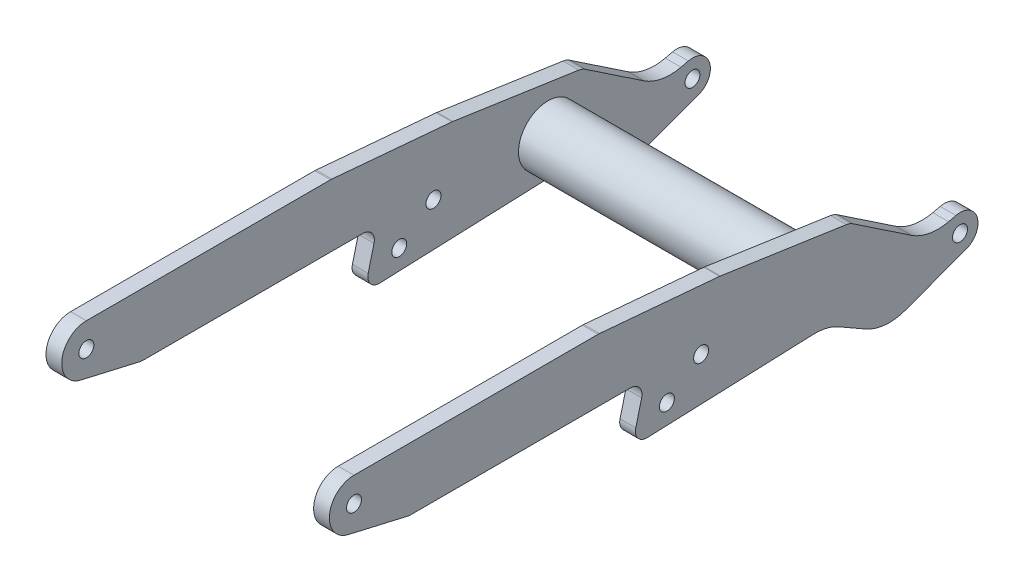
from build123d import *

# Parameters (mm, degrees)
SKETCH1_R                = 0.95
BOSS_EXTRUDE1_DEPTH      = 18
FILLET1_R                = 2
CUT_EXTRUDE1_DEPTH       = 83.510909783
CUT_EXTRUDE1_DEPTH_BACK  = 83.510909783
SKETCH2_W                = 32
SKETCH2_H                = 82.41
BOSS_EXTRUDE2_DEPTH      = 18
BOSS_EXTRUDE2_DEPTH_BACK = 16
SKETCH3_R                = 3.75


with BuildPart() as part:
    # Sketch1 → Boss-Extrude1 (new, symmetric)
    with BuildSketch(Plane(origin=(0, 0, 0), x_dir=(0, 0, -1), z_dir=(1, 0, 0))):
        with BuildLine():
            Line((0, 3.13), (31.1, 3.13))
            Line((31.1, 3.13), (46.5, 1.782674582))
            Line((46.5, 1.782674582), (63, -0.639122384))
            Line((63, -0.639122384), (70.830854785, -5.891324783))
            ThreePointArc((70.830854785, -5.891324783), (73.097482442, -6.811154728), (75.542872081, -6.749855612))
            Line((75.542872081, -6.749855612), (76.479440337, -6.530221264))
            ThreePointArc((76.479440337, -6.530221264), (79.183707452, -8.094392066), (77.788191978, -10.889428289))
            Line((77.788191978, -10.889428289), (70.085210842, -13.7273023))
            ThreePointArc((70.085210842, -13.7273023), (67.51150317, -14.076398492), (65.031397439, -13.305091226))
            Line((65.031397439, -13.305091226), (61.593330792, -11.338037731))
            ThreePointArc((61.593330792, -11.338037731), (60.042423522, -10.718485849), (58.380824128, -10.550422334))
            Line((58.380824128, -10.550422334), (37.261773194, -11.370750671))
            ThreePointArc((37.261773194, -11.370750671), (36.078702039, -10.834444885), (35.799894202, -9.565765476))
            Line((35.799894202, -9.565765476), (36.542469609, -6.634487021))
            ThreePointArc((36.542469609, -6.634487021), (36.281163577, -5.387851181), (35.136870597, -4.828409195))
            Line((35.136870597, -4.828409195), (7, -4.828409195))
            Line((7, -4.828409195), (-0.7040968, -3.049778303))
            ThreePointArc((-0.7040968, -3.049778303), (-3.109879908, 0.354326059), (0, 3.13))
        make_face()
        Circle(SKETCH1_R, mode=Mode.SUBTRACT)
        with Locations((44.1, -5.6)):
            Circle(SKETCH1_R, mode=Mode.SUBTRACT)
        with Locations((39.75, -8.75)):
            Circle(SKETCH1_R, mode=Mode.SUBTRACT)
        with Locations((77, -8.75)):
            Circle(SKETCH1_R, mode=Mode.SUBTRACT)
    extrude(amount=BOSS_EXTRUDE1_DEPTH, both=True)

    # Fillet1
    # the kernel refuses this fillet: 2 mm, written as the material it takes off along each edge
    with BuildSketch(Plane(origin=(19.131384491, -0.639122384, -63), x_dir=(0, -0.557020574337694, -0.8304986934152909), z_dir=(-1, 0, 0))) as fillet1_piece_1:
        with BuildLine():
            CenterArc((FILLET1_R * 0.226276898255, FILLET1_R), FILLET1_R, 244.5, 25.5)
            Line((-FILLET1_R * 0.204234198553, FILLET1_R * 0.0974147156501), (0, 0))
            Line((0, 0), (FILLET1_R * 0.226276898255, 0))
        make_face()
    extrude(amount=38.262768983, mode=Mode.SUBTRACT)
    with BuildSketch(Plane(origin=(-18.569678042, -4.828409195, -7), x_dir=(0, 0.22495105434386356, 0.9743700647852356), z_dir=(1, 0, 0))) as fillet1_piece_2:
        with BuildLine():
            CenterArc((FILLET1_R * 0.113935608302, -FILLET1_R), FILLET1_R, 90, 13)
            Line((-FILLET1_R * 0.111015446042, -FILLET1_R * 0.0256299352148), (0, 0))
            Line((0, 0), (FILLET1_R * 0.113935608302, 0))
        make_face()
    extrude(amount=37.139356083, mode=Mode.SUBTRACT)
    with BuildSketch(Plane(origin=(18.218304715, 3.13, -31.1), x_dir=(0, 0, 1), z_dir=(-1, 0, 0))) as fillet1_piece_3:
        with BuildLine():
            CenterArc((FILLET1_R * 0.0436609429085, -FILLET1_R), FILLET1_R, 90, 5)
            Line((-FILLET1_R * 0.0434947998391, -FILLET1_R * 0.00380530190825), (0, 0))
            Line((0, 0), (FILLET1_R * 0.0436609429085, 0))
        make_face()
    extrude(amount=36.436609429, mode=Mode.SUBTRACT)
    with BuildSketch(Plane(origin=(18.14621298, 1.782674582, -46.5), x_dir=(0, -0.14521967007723557, -0.9893994377513355), z_dir=(-1, 0, 0))) as fillet1_piece_4:
        with BuildLine():
            CenterArc((FILLET1_R * 0.0292425960983, FILLET1_R), FILLET1_R, 266.65, 3.35)
            Line((-FILLET1_R * 0.02919262642, FILLET1_R * 0.00170879761001), (0, 0))
            Line((0, 0), (FILLET1_R * 0.0292425960983, 0))
        make_face()
    extrude(amount=36.292425961, mode=Mode.SUBTRACT)

    # Sketch2 → Cut-Extrude1 (cut, two sides: drawn at the far end of the back side and taken through both)
    with BuildSketch(Plane(origin=(0, 0, 0), x_dir=(1, 0, 0), z_dir=(0, 1, 0)).offset(-CUT_EXTRUDE1_DEPTH_BACK)):
        with Locations((0, 38.075)):
            Rectangle(SKETCH2_W, SKETCH2_H)
    extrude(amount=CUT_EXTRUDE1_DEPTH + CUT_EXTRUDE1_DEPTH_BACK, mode=Mode.SUBTRACT)


with BuildPart() as cut_extrude1_piece_1:
    # of the separate pieces the step leaves, piece 1, a body of its own (cut_extrude1_pieces)
    add(part.part.solids().sort_by_distance((16, 3.13, 0))[0])



with BuildPart() as cut_extrude1_piece_2:
    # of the separate pieces the step leaves, piece 2, a body of its own (cut_extrude1_pieces)
    add(part.part.solids().sort_by_distance((-18, 3.13, 0))[0])


with BuildPart() as cut_extrude1_piece_1_1:
    add(cut_extrude1_piece_1.part)

    add(cut_extrude1_piece_2.part)  # Boss-Extrude2 merges Cut-Extrude1 piece 2
    # Sketch3 → Boss-Extrude2 (add, two sides: drawn at the far end of the back side and taken through both)
    with BuildSketch(Plane(origin=(0, 0, 0), x_dir=(0, 0, -1), z_dir=(1, 0, 0)).offset(-BOSS_EXTRUDE2_DEPTH_BACK)):
        with Locations((58.65, -5.75)):
            Circle(SKETCH3_R)
    extrude(amount=BOSS_EXTRUDE2_DEPTH + BOSS_EXTRUDE2_DEPTH_BACK)


solid = cut_extrude1_piece_1_1.part
